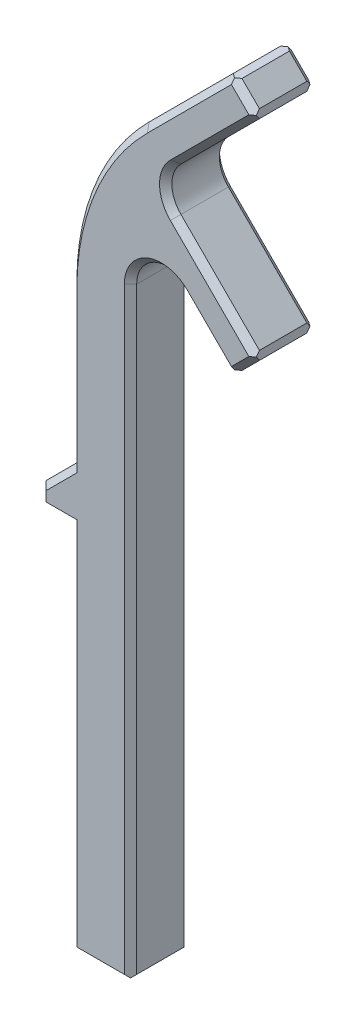
from build123d import *

# Parameters (mm, degrees)
BOSS_EXTRUDE1_DEPTH = 4.85
FILLET1_R           = 5
FILLET2_R           = 40
FILLET3_R           = 5
CHAMFER1_SIZE       = 1
CHAMFER2_SIZE       = 1
CHAMFER3_SIZE       = 1
BOSS_EXTRUDE2_START = -9.7
BOSS_EXTRUDE2_DEPTH = 9.7
CHAMFER4_SIZE       = 1


with BuildPart() as part:
    # Sketch1 → Boss-Extrude1 (new, symmetric)
    with BuildSketch(Plane.XY):
        Polygon((4.85, 55), (21.213203436, 38.636796564), (25.455844123, 42.879437252), (8.485281374, 59.85), (25.455844123, 76.820562748), (21.213203436, 81.063203436), (-4.85, 55), (-4.85, -55), (4.85, -55), align=None)
    extrude(amount=BOSS_EXTRUDE1_DEPTH, both=True)

    # Fillet1
    fillet1_edges = [part.edges().sort_by_distance(p)[0] for p in [
        (4.85, 55, 0),
    ]]
    fillet(fillet1_edges, radius=FILLET1_R)

    # Fillet2
    fillet2_edges = [part.edges().sort_by_distance(p)[0] for p in [
        (-4.85, 55, 0),
    ]]
    fillet(fillet2_edges, radius=FILLET2_R)

    # Fillet3
    fillet3_edges = [part.edges().sort_by_distance(p)[0] for p in [
        (8.485281374, 59.85, 0),
    ]]
    fillet(fillet3_edges, radius=FILLET3_R)

    # Chamfer1
    chamfer1_edges = [part.edges().sort_by_distance(p)[0] for p in [
        (21.213203436, 81.063203436, 0),
        (25.455844123, 76.820562748, 0),
        (25.455844123, 42.879437252, 0),
        (21.213203436, 38.636796564, 0),
    ]]
    chamfer(chamfer1_edges, length=CHAMFER1_SIZE)

    # Chamfer2
    # the kernel refuses this chamfer: 1 mm, written as the material it takes off along each edge
    with BuildSketch(Plane(origin=(-4.85, 38.431457505, -4.85), x_dir=(0.9996219169112968, 0, -0.027495876610586487), z_dir=(0, -1, 0)), Plane(origin=(-4.85, 38.431457505, 4.85), x_dir=(-0.027495876610586487, 0, -0.9996219169112968), z_dir=(0, -1, 0))) as chamfer2_piece_1:
        Polygon((CHAMFER2_SIZE * 0.999621916911, CHAMFER2_SIZE * 0.0274958766106), (-CHAMFER2_SIZE * 0.0274958766106, CHAMFER2_SIZE * 0.999621916911), (0, 0), align=None)
    extrude(amount=96.003140493, mode=Mode.SUBTRACT)
    with BuildSketch(Plane(origin=(35.15, 38.431457505, -4.85), x_dir=(-1, 0, 0), z_dir=(0, -1, 0))) as chamfer2_piece_2:
        Polygon((40 - CHAMFER2_SIZE, 0), (40, -CHAMFER2_SIZE), (40, 0), align=None)
    revolve(axis=Axis((35.15, 38.431457505, -4.85), (0, 0, -1)), revolution_arc=45, mode=Mode.SUBTRACT)
    with BuildSketch(Plane(origin=(22.324551134, 82.174551134, -4.85), x_dir=(0.7068394360706736, -0.7068394360706733, -0.027495876610586494), z_dir=(-0.7071067811865475, -0.7071067811865477, 0)), Plane(origin=(22.324551134, 82.174551134, 4.85), x_dir=(-0.019442520806010343, 0.019442520806010336, -0.999621916911297), z_dir=(-0.7071067811865475, -0.7071067811865477, 0))) as chamfer2_piece_3:
        Polygon((CHAMFER2_SIZE * 0.999621916911, CHAMFER2_SIZE * 0.0274958766106), (-CHAMFER2_SIZE * 0.0274958766106, CHAMFER2_SIZE * 0.999621916911), (0, 0), align=None)
    extrude(amount=21.862076271, mode=Mode.SUBTRACT)
    with BuildSketch(Plane(origin=(26.567191821, 75.70921505, -4.85), x_dir=(-0.7068394360706752, -0.7068394360706718, -0.02749587661058676), z_dir=(-0.7071067811865458, 0.7071067811865493, 0)), Plane(origin=(26.567191821, 75.70921505, 4.85), x_dir=(0.019442520806010388, 0.019442520806010295, -0.999621916911297), z_dir=(-0.7071067811865458, 0.7071067811865493, 0)), Plane(origin=(20.101855737, 37.525448866, -4.85), x_dir=(-0.7068394360706738, 0.7068394360706732, -0.027495876610586494), z_dir=(0.7071067811865472, 0.7071067811865478, 0)), Plane(origin=(20.101855737, 37.525448866, 4.85), x_dir=(0.019442520806015523, -0.01944252080601551, -0.9996219169112968), z_dir=(0.7071067811865472, 0.7071067811865478, 0))) as chamfer2_piece_4:
        Polygon((CHAMFER2_SIZE * 0.999621916911, CHAMFER2_SIZE * 0.0274958766106), (-CHAMFER2_SIZE * 0.0274958766106, CHAMFER2_SIZE * 0.999621916911), (0, 0), align=None)
    extrude(amount=9.143365976, mode=Mode.SUBTRACT)
    with BuildSketch(Plane(origin=(35.15, 38.431457505, 4.85), x_dir=(-1, 0, 0), z_dir=(0, -1, 0))) as chamfer2_piece_5:
        Polygon((40, CHAMFER2_SIZE), (40 - CHAMFER2_SIZE, 0), (40, 0), align=None)
    revolve(axis=Axis((35.15, 38.431457505, 4.85), (0, 0, -1)), revolution_arc=45, mode=Mode.SUBTRACT)
    with BuildSketch(Plane(origin=(12.02081528, 63.385533906, 4.85), x_dir=(0.019442520806015513, -0.01944252080601552, -0.9996219169112968), z_dir=(0.7071067811865476, 0.7071067811865475, 0)), Plane(origin=(26.567191821, 41.768089553, 4.85), x_dir=(0.019442520806015516, 0.019442520806015516, -0.9996219169112968), z_dir=(-0.7071067811865476, 0.7071067811865476, 0)), Plane(origin=(12.02081528, 63.385533906, -4.85), x_dir=(-0.7068394360706736, 0.7068394360706736, -0.027495876610586462), z_dir=(0.7071067811865476, 0.7071067811865475, 0)), Plane(origin=(26.567191821, 41.768089553, -4.85), x_dir=(-0.7068394360706735, -0.7068394360706735, -0.027495876610586494), z_dir=(-0.7071067811865476, 0.7071067811865476, 0))) as chamfer2_piece_6:
        Polygon((CHAMFER2_SIZE * 0.999621916911, CHAMFER2_SIZE * 0.0274958766106), (-CHAMFER2_SIZE * 0.0274958766106, CHAMFER2_SIZE * 0.999621916911), (0, 0), align=None)
    extrude(amount=20.571682988, mode=Mode.SUBTRACT)
    with BuildSketch(Plane(origin=(15.556349186, 59.85, 4.85), x_dir=(-0.7071067811865474, 0.7071067811865477, 0), z_dir=(0.7071067811865477, 0.7071067811865474, 0))) as chamfer2_piece_7:
        Polygon((5, -CHAMFER2_SIZE), (5 + CHAMFER2_SIZE, 0), (5, 0), align=None)
    revolve(axis=Axis((15.556349186, 59.85, 4.85), (0, 0, 1)), revolution_arc=90, mode=Mode.SUBTRACT)
    with BuildSketch(Plane(origin=(15.556349186, 59.85, -4.85), x_dir=(-0.7071067811865474, 0.7071067811865477, 0), z_dir=(0.7071067811865477, 0.7071067811865474, 0))) as chamfer2_piece_8:
        Polygon((5 + CHAMFER2_SIZE, 0), (5, CHAMFER2_SIZE), (5, 0), align=None)
    revolve(axis=Axis((15.556349186, 59.85, -4.85), (0, 0, 1)), revolution_arc=90, mode=Mode.SUBTRACT)
    with BuildSketch(Plane(origin=(13.385533906, 46.464466094, -4.85), x_dir=(0.7068394360706735, 0.7068394360706737, -0.027495876610586462), z_dir=(0.7071067811865477, -0.7071067811865474, 0)), Plane(origin=(13.385533906, 46.464466094, 4.85), x_dir=(-0.019442520806016373, -0.01944252080601638, -0.9996219169112965), z_dir=(0.7071067811865477, -0.7071067811865474, 0))) as chamfer2_piece_9:
        Polygon((CHAMFER2_SIZE * 0.999621916911, CHAMFER2_SIZE * 0.0274958766106), (-CHAMFER2_SIZE * 0.0274958766106, CHAMFER2_SIZE * 0.999621916911), (0, 0), align=None)
    extrude(amount=12.641679399, mode=Mode.SUBTRACT)
    with BuildSketch(Plane(origin=(9.85, 42.928932188, -4.85), x_dir=(0.7071067811865479, 0.7071067811865471, 0), z_dir=(0.7071067811865471, -0.7071067811865479, 0))) as chamfer2_piece_10:
        Polygon((5 + CHAMFER2_SIZE, 0), (5, CHAMFER2_SIZE), (5, 0), align=None)
    revolve(axis=Axis((9.85, 42.928932188, -4.85), (0, 0, 1)), revolution_arc=135, mode=Mode.SUBTRACT)
    with BuildSketch(Plane(origin=(4.85, -57.571682988, -4.85), x_dir=(-0.9996219169112968, 0, -0.027495876610586487), z_dir=(0, 1, 0)), Plane(origin=(4.85, -57.571682988, 4.85), x_dir=(0.027495876610586487, 0, -0.9996219169112968), z_dir=(0, 1, 0))) as chamfer2_piece_11:
        Polygon((CHAMFER2_SIZE * 0.999621916911, CHAMFER2_SIZE * 0.0274958766106), (-CHAMFER2_SIZE * 0.0274958766106, CHAMFER2_SIZE * 0.999621916911), (0, 0), align=None)
    extrude(amount=100.500615176, mode=Mode.SUBTRACT)
    with BuildSketch(Plane(origin=(9.85, 42.928932188, 4.85), x_dir=(0.7071067811865479, 0.7071067811865471, 0), z_dir=(0.7071067811865471, -0.7071067811865479, 0))) as chamfer2_piece_12:
        Polygon((5, -CHAMFER2_SIZE), (5 + CHAMFER2_SIZE, 0), (5, 0), align=None)
    revolve(axis=Axis((9.85, 42.928932188, 4.85), (0, 0, 1)), revolution_arc=135, mode=Mode.SUBTRACT)

    # Chamfer3
    # the kernel refuses this chamfer: 1 mm, written as the material it takes off along each edge
    with BuildSketch(Plane(origin=(4.85, -55, 6.421682988), x_dir=(-0.9996219169112968, -0.027495876610589075, 0), z_dir=(0, 0, -1)), Plane(origin=(-6.421682988, -55, 4.85), x_dir=(0, -0.02749587661058907, -0.9996219169112965), z_dir=(1, 0, 0)), Plane(origin=(-6.421682988, -55, -4.85), x_dir=(0, 0.9996219169112968, -0.027495876610586414), z_dir=(1, 0, 0))) as chamfer3_piece_1:
        Polygon((CHAMFER3_SIZE * 0.999621916911, CHAMFER3_SIZE * 0.0274958766106), (-CHAMFER3_SIZE * 0.0274958766106, CHAMFER3_SIZE * 0.999621916911), (0, 0), align=None)
    extrude(amount=12.843365976, mode=Mode.SUBTRACT)
    with BuildSketch(Plane(origin=(-4.85, -55, 6.421682988), x_dir=(0.9996219169112968, -0.027495876610589075, 0), z_dir=(0, 0, -1))) as chamfer3_piece_2:
        Polygon((CHAMFER3_SIZE * 0.999621916911, -CHAMFER3_SIZE * 0.0274958766106), (-CHAMFER3_SIZE * 0.0274958766106, -CHAMFER3_SIZE * 0.999621916911), (0, 0), align=None)
    extrude(amount=12.843365976, mode=Mode.SUBTRACT)

    # Sketch2 → Boss-Extrude2 (add)
    with BuildSketch(Plane.XY.offset(4.85).offset(BOSS_EXTRUDE2_START)):
        Polygon((-3.85, 5), (-9.85, 5), (-9.85, 8), (-3.85, 14), align=None)
    extrude(amount=BOSS_EXTRUDE2_DEPTH)

    # Chamfer4
    chamfer4_edges = [part.edges().sort_by_distance(p)[0] for p in [
        (-6.85, 11, 4.85),
        (-9.85, 6.5, 4.85),
        (-6.85, 5, 4.85),
        (-6.85, 11, -4.85),
        (-9.85, 6.5, -4.85),
        (-6.85, 5, -4.85),
        (-9.85, 5, 0),
    ]]
    chamfer(chamfer4_edges, length=CHAMFER4_SIZE)


solid = part.part
